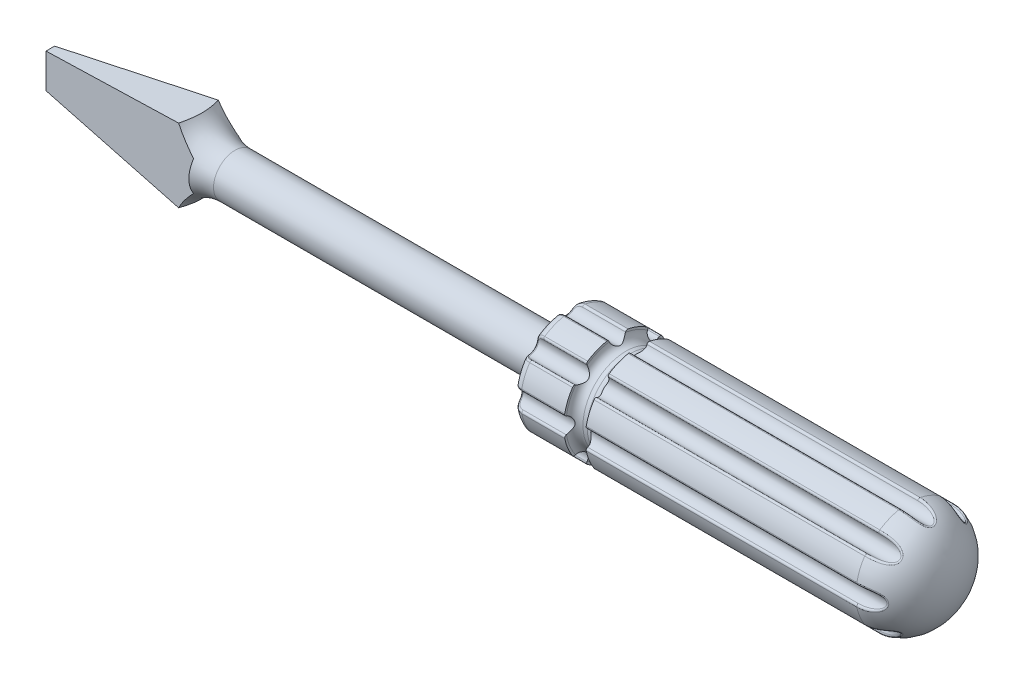
from build123d import *

# Parameters (mm, degrees)
SKETCH2_R                      = 2.5
BOSS_EXTRUDE1_DEPTH            = 43.5
SKETCH3_W                      = 16.5
SKETCH3_H                      = 16.5
BOSS_EXTRUDE2_DEPTH            = 8.25
FILLET1_R                      = 5
CUT_EXTRUDE7_REACH             = 64.772
CUT_EXTRUDE9_REACH             = 62.886
CUT_EXTRUDE9_DIRECTION_2_DEPTH = 16.5
FILLET3_R                      = 1
SKETCH9_R                      = 1
CUT_EXTRUDE10_DEPTH            = 61.647547473
FILLET4_R                      = 0.25
CIRPATTERN1_COUNT              = 8
FILLET4_OF_CIRPATTERN1_R       = 0.25


with BuildPart() as part:
    # Sketch1 → Revolve2 (revolve)
    with BuildSketch(Plane.XY):
        with BuildLine():
            Line((0, 0), (0, 6.25))
            Line((0, 6.25), (6, 6.25))
            Line((6, 6.25), (6, 5))
            Line((6, 5), (8.5, 5))
            Line((8.5, 5), (8.5, 6.25))
            Line((8.5, 6.25), (40, 6.25))
            add(Edge.make_bspline(
                [(45, 0), (45, 6.25), (40, 6.25)],
                knots=[1.570796327, 1.570796327, 1.570796327, 3.141592654, 3.141592654, 3.141592654], degree=2, weights=[1, 0.707106781, 1]))
            Line((45, 0), (0, 0))
        make_face()
    revolve(axis=Axis((0, 0, 0), (1, 0, 0)))

    # Sketch2 → Boss-Extrude1 (add)
    with BuildSketch(Plane.ZY):
        Circle(SKETCH2_R)
    extrude(amount=BOSS_EXTRUDE1_DEPTH)

    # Sketch3 → Boss-Extrude2 (add, symmetric)
    with BuildSketch(Plane.XY):
        with Locations((-51.75, 0)):
            Rectangle(SKETCH3_W, SKETCH3_H)
    extrude(amount=BOSS_EXTRUDE2_DEPTH, both=True)

    # Fillet1
    fillet1_edges = [part.edges().sort_by_distance(p)[0] for p in [
        (-43.5, 0, -2.5),
    ]]
    fillet(fillet1_edges, radius=FILLET1_R)

    # Sketch4 → Cut-Extrude7 (cut, up to next)
    with BuildSketch(Plane.XY.offset(8.25), mode=Mode.PRIVATE) as cut_extrude7_sk1:
        Polygon((-60, 2), (-39.981401138, 4.635498538), (-39.981401138, 8.25), (-60, 8.25), align=None)
    cut_extrude7_tool1 = extrude(cut_extrude7_sk1.sketch, amount=-CUT_EXTRUDE7_REACH, mode=Mode.PRIVATE) & part.part
    # Sketch4 → Cut-Extrude7 (cut, up to next)
    with BuildSketch(Plane.XY.offset(8.25), mode=Mode.PRIVATE) as cut_extrude7_sk2:
        Polygon((-39.981401138, -8.25), (-60, -8.25), (-60, -2), (-39.981401138, -4.635498538), align=None)
    cut_extrude7_tool2 = extrude(cut_extrude7_sk2.sketch, amount=-CUT_EXTRUDE7_REACH, mode=Mode.PRIVATE) & part.part
    add(cut_extrude7_tool1.solids().sort_by_distance((-50.882095, 5.725197, 8.25))[0], mode=Mode.SUBTRACT)
    add(cut_extrude7_tool2.solids().sort_by_distance((-50.882095, -5.725197, 8.25))[0], mode=Mode.SUBTRACT)

    # Sketch8 → Cut-Extrude9 (cut, up to next)
    with BuildSketch(Plane(origin=(0, 0, 0), x_dir=(1, 0, 0), z_dir=(0, 1, 0)), mode=Mode.PRIVATE) as cut_extrude9_sk1:
        Polygon((-60, 0.5), (-40.80927482, 2.517026494), (-40.80927482, 8.273020119), (-43.5, 8.25), (-60, 8.25), align=None)
    cut_extrude9_tool1 = extrude(cut_extrude9_sk1.sketch, amount=-CUT_EXTRUDE9_REACH, mode=Mode.PRIVATE) & part.part
    # Sketch8 → Cut-Extrude9 (cut, up to next)
    with BuildSketch(Plane(origin=(0, 0, 0), x_dir=(1, 0, 0), z_dir=(0, 1, 0)), mode=Mode.PRIVATE) as cut_extrude9_sk2:
        Polygon((-43.5, -8.25), (-60, -8.25), (-60, -0.5), (-40.80927482, -2.517026494), (-40.80927482, -8.25), align=None)
    cut_extrude9_tool2 = extrude(cut_extrude9_sk2.sketch, amount=-CUT_EXTRUDE9_REACH, mode=Mode.PRIVATE) & part.part
    add(cut_extrude9_tool1.solids().sort_by_distance((-50.880924, 0, -4.854926))[0], mode=Mode.SUBTRACT)
    add(cut_extrude9_tool2.solids().sort_by_distance((-50.88312, 0, 4.854111))[0], mode=Mode.SUBTRACT)

    # Sketch8 → Cut-Extrude9 direction 2 (cut)
    with BuildSketch(Plane(origin=(0, 0, 0), x_dir=(1, 0, 0), z_dir=(0, 1, 0))):
        Polygon((-60, 0.5), (-40.80927482, 2.517026494), (-40.80927482, 8.273020119), (-43.5, 8.25), (-60, 8.25), align=None)
        Polygon((-43.5, -8.25), (-60, -8.25), (-60, -0.5), (-40.80927482, -2.517026494), (-40.80927482, -8.25), align=None)
    extrude(amount=CUT_EXTRUDE9_DIRECTION_2_DEPTH, mode=Mode.SUBTRACT)

    # Fillet3
    fillet3_edges = [part.edges().sort_by_distance(p)[0] for p in [
        (8.5, -5, 0),
        (6, -5, 0),
        (0, -6.25, 0),
    ]]
    fillet(fillet3_edges, radius=FILLET3_R)

    # Sketch9 → Cut-Extrude10 (cut, through all)
    with BuildSketch(Plane.ZY):
        with Locations((0, 6.25)):
            Circle(SKETCH9_R)
    cut_extrude10 = extrude(amount=-CUT_EXTRUDE10_DEPTH, mode=Mode.SUBTRACT)

    # Fillet4
    fillet4_edges = [part.edges().sort_by_distance(p)[0] for p in [
        (0.148917123, 5.713078992, -0.843632478),
        (0.148917123, 5.713078992, 0.843632478),
        (41.621259201, 5.841439826, -0.912731381),
        (3.5, 6.17, -0.996794864),
        (3.5, 6.17, 0.996794864),
        (24.25, 6.17, -0.996794864),
        (24.25, 6.17, 0.996794864),
    ]]
    fillet(fillet4_edges, radius=FILLET4_R)

    # CirPattern1: Cut-Extrude10 ×8 about axis
    cirpattern1_axis = Axis((-43.5, 0, 0), (1, 0, 0))
    for i in range(1, CIRPATTERN1_COUNT):
        add(cut_extrude10.rotate(cirpattern1_axis, i * 360 / CIRPATTERN1_COUNT), mode=Mode.SUBTRACT)

    # Fillet4 of CirPattern1
    fillet4_of_cirpattern1_edges = [part.edges().sort_by_distance(p)[0] for p in [
        (0.148917123, 4.636295143, 3.443218651),
        (0.148917123, 3.443218651, 4.636295143),
        (41.621259201, 4.775920262, 3.485123164),
        (3.5, 5.067689247, 3.658008432),
        (3.5, 3.658008432, 5.067689247),
        (24.25, 5.067689247, 3.658008432),
        (24.25, 3.658008432, 5.067689247),
        (0.148917123, 0.843632478, 5.713078992),
        (0.148917123, -0.843632478, 5.713078992),
        (41.621259201, 0.912731381, 5.841439826),
        (3.5, 0.996794864, 6.17),
        (3.5, -0.996794864, 6.17),
        (24.25, 0.996794864, 6.17),
        (24.25, -0.996794864, 6.17),
        (0.148917123, -3.443218651, 4.636295143),
        (0.148917123, -4.636295143, 3.443218651),
        (41.621259201, -3.485123164, 4.775920262),
        (3.5, -3.658008432, 5.067689247),
        (3.5, -5.067689247, 3.658008432),
        (24.25, -3.658008432, 5.067689247),
        (24.25, -5.067689247, 3.658008432),
        (0.148917123, -5.713078992, 0.843632478),
        (0.148917123, -5.713078992, -0.843632478),
        (41.621259201, -5.841439826, 0.912731381),
        (3.5, -6.17, 0.996794864),
        (3.5, -6.17, -0.996794864),
        (24.25, -6.17, 0.996794864),
        (24.25, -6.17, -0.996794864),
        (0.148917123, -4.636295143, -3.443218651),
        (0.148917123, -3.443218651, -4.636295143),
        (41.621259201, -4.775920262, -3.485123164),
        (3.5, -5.067689247, -3.658008432),
        (3.5, -3.658008432, -5.067689247),
        (24.25, -5.067689247, -3.658008432),
        (24.25, -3.658008432, -5.067689247),
        (0.148917123, -0.843632478, -5.713078992),
        (0.148917123, 0.843632478, -5.713078992),
        (41.621259201, -0.912731381, -5.841439826),
        (3.5, -0.996794864, -6.17),
        (3.5, 0.996794864, -6.17),
        (24.25, -0.996794864, -6.17),
        (24.25, 0.996794864, -6.17),
        (0.148917123, 3.443218651, -4.636295143),
        (0.148917123, 4.636295143, -3.443218651),
        (41.621259201, 3.485123164, -4.775920262),
        (3.5, 3.658008432, -5.067689247),
        (3.5, 5.067689247, -3.658008432),
        (24.25, 3.658008432, -5.067689247),
        (24.25, 5.067689247, -3.658008432),
    ]]
    fillet(fillet4_of_cirpattern1_edges, radius=FILLET4_OF_CIRPATTERN1_R)


solid = part.part
